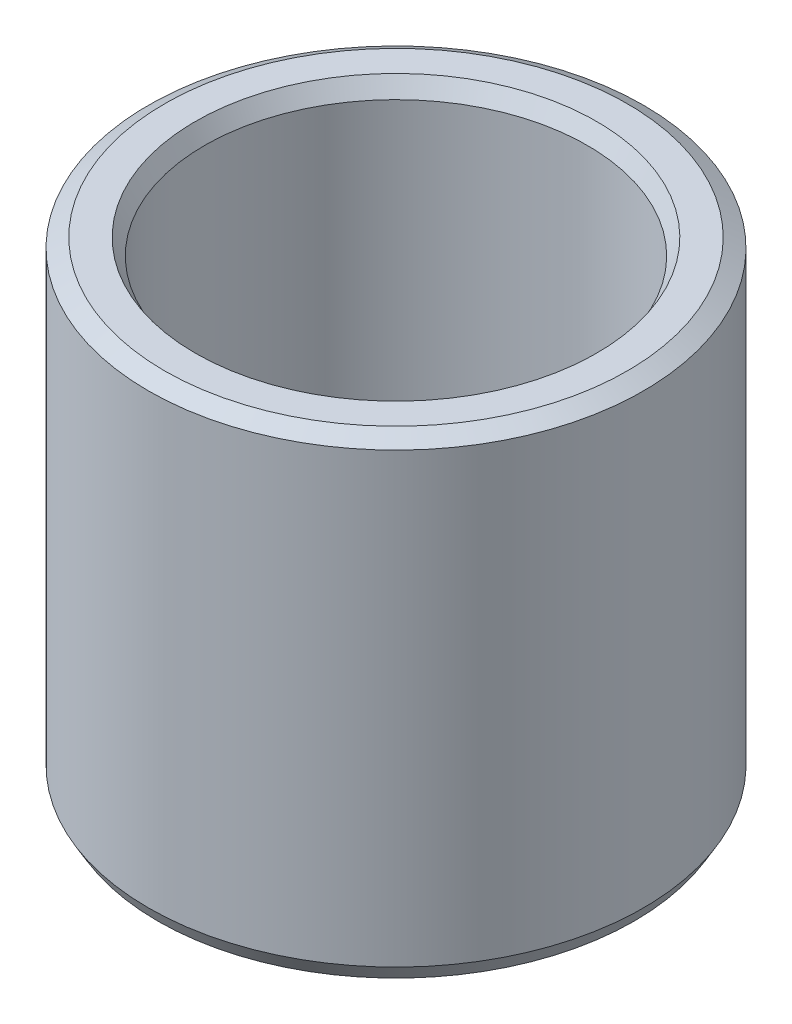
from build123d import *
from OCP.BRepFilletAPI import BRepFilletAPI_MakeChamfer

# Parameters (mm, degrees)
SKETCH1_R           = 35
BOSS_EXTRUDE1_DEPTH = 66.90738259
SKETCH2_R           = 27.069454531
CUT_EXTRUDE1_DEPTH  = 84.226184852
CHAMFER1_SIZE       = 1.315185349
CHAMFER1_SIZE2      = 2.277967846


with BuildPart() as part:
    # Sketch1 → Boss-Extrude1 (new body)
    with BuildSketch(Plane(origin=(0, 0, 0), x_dir=(1, 0, 0), z_dir=(0, 1, 0))):
        Circle(SKETCH1_R)
    extrude(amount=BOSS_EXTRUDE1_DEPTH)

    # Sketch2 → Cut-Extrude1 (cut, through all)
    with BuildSketch(Plane(origin=(0, 0, 0), x_dir=(1, 0, 0), z_dir=(0, 1, 0))):
        Circle(SKETCH2_R)
    extrude(amount=CUT_EXTRUDE1_DEPTH, mode=Mode.SUBTRACT)

    # Chamfer1: one chamfer whose edges measure the first distance from different faces: ONE call of the kernel's chamfer builder (chamfer() names one face for all edges)
    chamfer1_edges_1 = [part.edges().sort_by_distance(p)[0] for p in [
        (-27.069454531, 66.90738259, 0),
    ]]
    chamfer1_side_1 = [part.faces().sort_by_distance(p)[0] for p in [
        (-34.010050506, 66.90738259, 0),
    ]]
    chamfer1_edges_2 = [part.edges().sort_by_distance(p)[0] for p in [
        (-27.069454531, 0, 0),
    ]]
    chamfer1_side_2 = [part.faces().sort_by_distance(p)[0] for p in [
        (-27.069454531, 33.453691295, 0),
    ]]
    chamfer1_edges_3 = [part.edges().sort_by_distance(p)[0] for p in [
        (-35, 0, 0),
    ]]
    chamfer1_side_3 = [part.faces().sort_by_distance(p)[0] for p in [
        (-34.010050506, 0, 0),
    ]]
    chamfer1_edges_4 = [part.edges().sort_by_distance(p)[0] for p in [
        (-35, 66.90738259, 0),
    ]]
    chamfer1_side_4 = [part.faces().sort_by_distance(p)[0] for p in [
        (-35, 33.453691295, 0),
    ]]
    chamfer1 = BRepFilletAPI_MakeChamfer(part.part.solid().wrapped)
    for e in chamfer1_edges_1:
        chamfer1.Add(CHAMFER1_SIZE, CHAMFER1_SIZE2, e.wrapped, chamfer1_side_1[0].wrapped)  # the first distance lies on this face
    for e in chamfer1_edges_2:
        chamfer1.Add(CHAMFER1_SIZE, CHAMFER1_SIZE2, e.wrapped, chamfer1_side_2[0].wrapped)  # the first distance lies on this face
    for e in chamfer1_edges_3:
        chamfer1.Add(CHAMFER1_SIZE, CHAMFER1_SIZE2, e.wrapped, chamfer1_side_3[0].wrapped)  # the first distance lies on this face
    for e in chamfer1_edges_4:
        chamfer1.Add(CHAMFER1_SIZE, CHAMFER1_SIZE2, e.wrapped, chamfer1_side_4[0].wrapped)  # the first distance lies on this face
    add(Compound.cast(chamfer1.Shape()), mode=Mode.REPLACE)


solid = part.part
